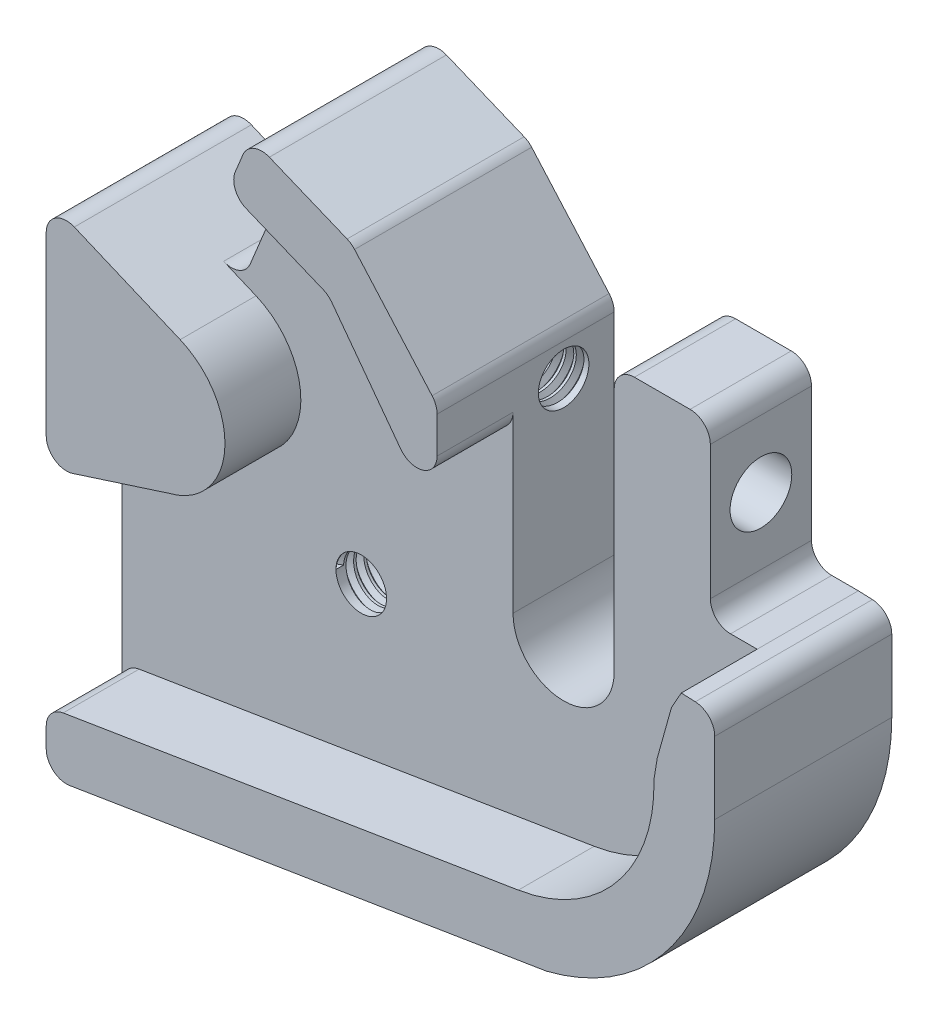
from build123d import *

# Parameters (mm, degrees)
BOSS_EXTRUDE2_DEPTH             = 10
BOSS_EXTRUDE3_DEPTH             = 17.5
TAP_DRILL_FOR_M6X1_0_TAP3_D     = 5
TAP_DRILL_FOR_M6X1_0_TAP3_DEPTH = 43
TAP_DRILL_FOR_M6X1_0_TAP3_TIP   = 1.5021515475689007
FILLET1_R                       = 2
TAP_DRILL_FOR_M6X1_0_TAP2_D     = 5
THREAD1_PITCH                   = 1
SKETCH2_R                       = 3.05
CUT_EXTRUDE2_DEPTH              = 9.999999999999996
THREAD2_PITCH                   = 1


with BuildPart() as part:
    # Sketch1 → Boss-Extrude2 (new body)
    with BuildSketch(Plane.XY):
        with BuildLine():
            Line((23.224596799831595, 11.838054320739976), (18.594616956763275, 11.838054320739976))
            Line((18.594616956763275, 11.838054320739976), (18.594616956763275, 29.0520343287084))
            Line((18.594616956763275, 29.052034328708398), (9.094616956763277, 29.052034328708398))
            Line((9.094616956763277, 29.052034328708398), (9.094616956763272, 2.8469015838410883))
            ThreePointArc((9.094616956763272, 2.846901583841089), (4.094616956762875, -2.153098416158908), (-0.9053830432367223, 2.846901583841888))
            Line((-0.905383043236724, 2.8469015838418885), (-0.9053830432367259, 24.399326740540857))
            Line((-0.9053830432367259, 24.399326740540857), (-9.372834944506629, 34.00764813303465))
            Line((-9.372834944506627, 34.00764813303465), (-19.338054555793107, 38.10430027910595))
            Line((-19.338054555793107, 38.10430027910595), (-27.64949584669558, 17.88648954074799))
            Line((-27.64949584669558, 17.886489540747988), (-39.54243331524863, 22.895355765149752))
            Line((-39.54243331524863, 22.895355765149752), (-39.54243331524862, -26.68595837588142))
            Line((-39.54243331524862, -26.68595837588142), (9.930508904802714, -18.62730077710855))
            ThreePointArc((9.93050890480271, -18.62730077710854), (21.888607340272777, -10.842166970276775), (26.528997575110665, 2.651209369657105))
            Line((26.52899757511066, 2.6512093696571046), (26.528997575110658, 11.699388504326581))
            Line((26.528997575110658, 11.699388504326581), (23.22459679983159, 11.838054320739976))
        make_face()
    extrude(amount=BOSS_EXTRUDE2_DEPTH)

    # Sketch1<7> → Boss-Extrude3 (add)
    with BuildSketch(Plane.XY):
        Polygon((-0.9053830432367259, 14.019993611037982), (-0.9053830432367259, 24.399326740540857), (-9.372834944506629, 34.00764813303465), (-19.338054555793107, 38.10430027910595), (-21.61937542853537, 32.55492418123779), (-11.654155817248892, 28.458272035166488), align=None)
        with BuildLine():
            Line((20.85012579434564, 5.080010210629205), (20.52330351237285, 3.0772079508363284))
            ThreePointArc((20.523303512372856, 3.0772079508363284), (16.858734444980243, -7.523493754122956), (7.118615678125689, -13.085330635476565))
            Line((7.118615678125689, -13.085330635476566), (-39.542433315248616, -20.685958375881416))
            Line((-39.54243331524862, -20.685958375881416), (-39.54243331524862, -26.68595837588142))
            Line((-39.54243331524862, -26.68595837588142), (9.930508904802714, -18.62730077710855))
            ThreePointArc((9.93050890480271, -18.62730077710854), (21.888607340272777, -10.842166970276775), (26.528997575110665, 2.651209369657105))
            Line((26.52899757511066, 2.6512093696571046), (26.528997575110658, 11.699388504326581))
            Line((26.528997575110658, 11.699388504326581), (23.22459679983159, 11.838054320739976))
            Line((23.224596799831595, 11.838054320739976), (22.25718626662765, 10.122973627008314))
            Line((22.25718626662765, 10.122973627008314), (20.85012579434564, 5.080010210629205))
        make_face()
        with BuildLine():
            Line((-26.30362524162322, 17.319658525787453), (-39.54243331524863, 22.895355765149752))
            Line((-39.54243331524863, 22.895355765149752), (-39.54243331524863, -0.28742000905455))
            Line((-39.54243331524863, -0.28742000905455056), (-27.37216227343774, 3.626296889654118))
            ThreePointArc((-27.372162273437734, 3.6262968896540997), (-21.8978313295958, 10.087488754460773), (-26.30362524162322, 17.319658525787453))
        make_face()
    extrude(amount=BOSS_EXTRUDE3_DEPTH)

    # Tap Drill for M6x1.0 Tap3
    with Locations(Plane(origin=(18.594616957, 20.445044325, 5), x_dir=(0, 0, 1), z_dir=(1, 0, 0))):
        with Locations((0, 0)):
            Hole(TAP_DRILL_FOR_M6X1_0_TAP3_D / 2, depth=TAP_DRILL_FOR_M6X1_0_TAP3_DEPTH)
            with Locations((0, 0, -(TAP_DRILL_FOR_M6X1_0_TAP3_DEPTH + TAP_DRILL_FOR_M6X1_0_TAP3_TIP / 2))):  # 118° drill point
                Cone(0, TAP_DRILL_FOR_M6X1_0_TAP3_D / 2, TAP_DRILL_FOR_M6X1_0_TAP3_TIP, mode=Mode.SUBTRACT)

    # Fillet1
    fillet1_edges = [part.edges().sort_by_distance(p)[0] for p in [
        (-21.61937542853537, 32.55492418123779, 13.75),
        (-11.654155817248892, 28.458272035166488, 13.75),
        (-0.9053830432367262, 14.019993611037982, 13.75),
        (-39.54243331524863, -0.2874200090545503, 13.75),
        (9.094616956763277, 29.052034328708398, 5),
        (18.594616956763275, 29.0520343287084, 5),
        (18.594616956763275, 11.838054320739976, 5),
        (26.528997575110658, 11.699388504326581, 8.75),
        (-39.54243331524862, -26.68595837588142, 8.75),
        (-39.54243331524863, 22.895355765149752, 8.75),
        (-27.64949584669558, 17.886489540747988, 5),
        (-19.338054555793107, 38.10430027910595, 8.75),
        (-9.372834944506629, 34.00764813303465, 8.75),
        (-0.9053830432367259, 24.399326740540857, 8.75),
        (-39.542433315248616, -20.685958375881416, 13.75),
    ]]
    fillet(fillet1_edges, radius=FILLET1_R)

    # Tap Drill for M6x1.0 Tap2 (through all)
    with Locations(Plane(origin=(-15.905383043, -2.153098416, 10), x_dir=(1, 0, 0), z_dir=(0, 0, 1))):
        with Locations((0, 0)):
            Hole(TAP_DRILL_FOR_M6X1_0_TAP2_D / 2)

    # Thread1: the profile of Thread Profile2 profile screwed along a right-hand helix of 23 turns, 8 arcs to a turn; built about Z, then put on its axis
    thread1_z = Axis((0, 0, 0), (0, 0, 1))
    thread1_corners = [(2.4997, 0, -0.000173205), (3.041265875, 0, 0.312499999), (3.041265875, 0, 0.437499999), (2.4997, 0, 0.750173203)]
    with BuildLine(mode=Mode.PRIVATE) as thread1_profile:
        Line(thread1_corners[0], thread1_corners[1])
        Line(thread1_corners[1], thread1_corners[2])
        Line(thread1_corners[2], thread1_corners[3])
        Line(thread1_corners[3], thread1_corners[0])
    thread1_cap = Face(thread1_profile.wire())
    thread1_turn_angles = [0, 22.5, 45, 67.5, 90, 112.5, 135, 157.5, 180, 202.5, 225, 247.5, 270, 292.5, 315, 337.5, 360]
    thread1_turn_weights = [1, 0.9238795325112867, 1, 0.9238795325112867, 1, 0.9238795325112867, 1, 0.9238795325112867, 1, 0.9238795325112867, 1, 0.9238795325112867, 1, 0.9238795325112867, 1, 0.9238795325112867, 1]
    thread1_turn_rails = [Edge.make_bspline([Vector(p[0], p[1], 0).rotate(thread1_z, thread1_turn_angles[k]) / thread1_turn_weights[k] + Vector(0, 0, p[2] + THREAD1_PITCH * thread1_turn_angles[k] / 360) for k in range(17)], [0, 0, 0, 1, 1, 2, 2, 3, 3, 4, 4, 5, 5, 6, 6, 7, 7, 8, 8, 8], 2, thread1_turn_weights) for p in thread1_corners]
    thread1_turn_sides = [Face.make_surface_from_curves(thread1_turn_rails[p[0]], thread1_turn_rails[p[1]]) for p in [(0, 1), (1, 2), (2, 3), (3, 0)]]
    thread1 = Plane(origin=(-0.905383043, 20.445044325, 5), x_dir=(0, 0, 1), z_dir=(-1, 0, 0)) * Solid(Shell([*[p.moved(Location((0, 0, THREAD1_PITCH * i))) for i in range(23) for p in thread1_turn_sides], thread1_cap, thread1_cap.rotate(thread1_z, 8280).moved(Location((0, 0, THREAD1_PITCH * 8280 / 360)))]))
    add(thread1, mode=Mode.SUBTRACT)

    # Sketch2 → Cut-Extrude2 (cut)
    with BuildSketch(Plane(origin=(18.594616956763275, 0, 0), x_dir=(0, 0, -1), z_dir=(1, 0, 0))):
        with Locations((-4.999999999999999, 20.445044324724186)):
            Circle(SKETCH2_R)
    extrude(amount=-CUT_EXTRUDE2_DEPTH, mode=Mode.SUBTRACT)

    # Thread2: the profile of Thread Profile3 profile screwed along a right-hand helix of 13 turns, 8 arcs to a turn; built about Z, then put on its axis
    thread2_z = Axis((0, 0, 0), (0, 0, 1))
    thread2_corners = [(2.4997, 0, -0.000173205), (3.041265875, 0, 0.312499999), (3.041265875, 0, 0.437499999), (2.4997, 0, 0.750173202)]
    with BuildLine(mode=Mode.PRIVATE) as thread2_profile:
        Line(thread2_corners[0], thread2_corners[1])
        Line(thread2_corners[1], thread2_corners[2])
        Line(thread2_corners[2], thread2_corners[3])
        Line(thread2_corners[3], thread2_corners[0])
    thread2_cap = Face(thread2_profile.wire())
    thread2_turn_angles = [0, 22.5, 45, 67.5, 90, 112.5, 135, 157.5, 180, 202.5, 225, 247.5, 270, 292.5, 315, 337.5, 360]
    thread2_turn_weights = [1, 0.9238795325112867, 1, 0.9238795325112867, 1, 0.9238795325112867, 1, 0.9238795325112867, 1, 0.9238795325112867, 1, 0.9238795325112867, 1, 0.9238795325112867, 1, 0.9238795325112867, 1]
    thread2_turn_rails = [Edge.make_bspline([Vector(p[0], p[1], 0).rotate(thread2_z, thread2_turn_angles[k]) / thread2_turn_weights[k] + Vector(0, 0, p[2] + THREAD2_PITCH * thread2_turn_angles[k] / 360) for k in range(17)], [0, 0, 0, 1, 1, 2, 2, 3, 3, 4, 4, 5, 5, 6, 6, 7, 7, 8, 8, 8], 2, thread2_turn_weights) for p in thread2_corners]
    thread2_turn_sides = [Face.make_surface_from_curves(thread2_turn_rails[p[0]], thread2_turn_rails[p[1]]) for p in [(0, 1), (1, 2), (2, 3), (3, 0)]]
    thread2 = Plane(origin=(-15.905383043, -2.153098416, 10), x_dir=(-1, 0, 0), z_dir=(0, 0, -1)) * Solid(Shell([*[p.moved(Location((0, 0, THREAD2_PITCH * i))) for i in range(13) for p in thread2_turn_sides], thread2_cap, thread2_cap.rotate(thread2_z, 4680).moved(Location((0, 0, THREAD2_PITCH * 4680 / 360)))]))
    add(thread2, mode=Mode.SUBTRACT)


solid = part.part
